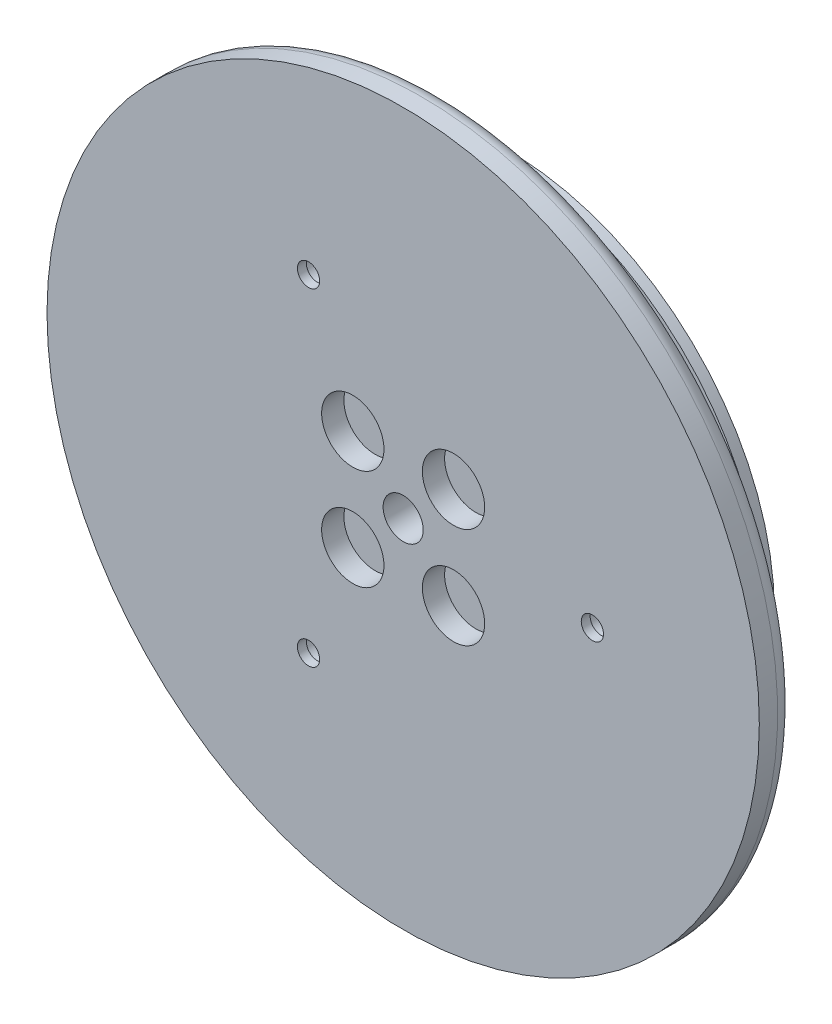
from build123d import *

# Parameters (mm, degrees)
SKETCH1_R             = 30
SKETCH1_R_2           = 12.5
BOSS_EXTRUDE1_DEPTH   = 6
SKETCH2_R             = 40
SKETCH2_R_2           = 2.25
SKETCH2_R_3           = 1.5
BOSS_EXTRUDE2_DEPTH   = 4
SKETCH3_R             = 3.5
CUT_EXTRUDE1_DEPTH    = 2.5
SKETCH4_R             = 5.15
CUT_EXTRUDE2_DEPTH    = 3
SKETCH5_R             = 3.5
BOSS_EXTRUDE3_DEPTH   = 0.2
SKETCH6_R             = 1.25
CUT_EXTRUDE3_DEPTH    = 10
SKETCH7_R             = 3.125
CUT_EXTRUDE4_DEPTH    = 9
SKETCH8_R             = 2
CUT_EXTRUDE5_DEPTH    = 8
SKETCH9_R             = 3
BOSS_EXTRUDE4_DEPTH   = 0.5
BOSS_EXTRUDE4_2_DEPTH = 0.5
BOSS_EXTRUDE4_3_DEPTH = 0.5
SKETCH11_R            = 3
SKETCH11_R_2          = 1.5
BOSS_EXTRUDE6_DEPTH   = 3
BOSS_EXTRUDE6_2_DEPTH = 3
BOSS_EXTRUDE6_3_DEPTH = 3
SKETCH10_R            = 30
SKETCH10_R_2          = 12.5
SKETCH10_R_3          = 5.15
SKETCH10_R_4          = 2
SKETCH10_R_5          = 3
BOSS_EXTRUDE7_DEPTH   = 1.2
FILLET1_R             = 10
FILLET2_R             = 2
BOSS_EXTRUDE8_START   = 2
SKETCH12_R            = 12.5
SKETCH12_R_2          = 2.25
SKETCH12_R_3          = 1.5
BOSS_EXTRUDE8_DEPTH   = 2
SKETCH13_R            = 3.125
BOSS_EXTRUDE9_DEPTH   = 1
FILLET3_R             = 1.5


with BuildPart() as part:
    # Sketch1 → Boss-Extrude1 (new body)
    with BuildSketch(Plane.XY):
        Circle(SKETCH1_R)
        Circle(SKETCH1_R_2, mode=Mode.SUBTRACT)
    extrude(amount=BOSS_EXTRUDE1_DEPTH)

    # Sketch2 → Boss-Extrude2 (add)
    with BuildSketch(Plane.XY.offset(6)):
        Circle(SKETCH2_R)
        Circle(SKETCH2_R_2, mode=Mode.SUBTRACT)
        with Locations((-5.655999742, 5.657708628)):
            Circle(SKETCH2_R_3, mode=Mode.SUBTRACT)
        with Locations((-5.655999742, -5.657708628)):
            Circle(SKETCH2_R_3, mode=Mode.SUBTRACT)
        with Locations((5.655999742, -5.657708628)):
            Circle(SKETCH2_R_3, mode=Mode.SUBTRACT)
        with Locations((5.655999742, 5.657708628)):
            Circle(SKETCH2_R_3, mode=Mode.SUBTRACT)
    extrude(amount=BOSS_EXTRUDE2_DEPTH)

    # Sketch3 → Cut-Extrude1 (cut)
    with BuildSketch(Plane.XY.offset(10)):
        with Locations((-5.655999742, 5.657708628)):
            Circle(SKETCH3_R)
        with Locations((5.655999742, 5.657708628)):
            Circle(SKETCH3_R)
        with Locations((5.655999742, -5.657708628)):
            Circle(SKETCH3_R)
        with Locations((-5.655999742, -5.657708628)):
            Circle(SKETCH3_R)
    extrude(amount=-CUT_EXTRUDE1_DEPTH, mode=Mode.SUBTRACT)

    # Sketch4 → Cut-Extrude2 (cut)
    with BuildSketch(Plane(origin=(0, 0, 0), x_dir=(-1, 0, 0), z_dir=(0, 0, -1))):
        with Locations((20, 0)):
            Circle(SKETCH4_R)
    extrude(amount=-CUT_EXTRUDE2_DEPTH, mode=Mode.SUBTRACT)

    # Sketch5 → Boss-Extrude3 (add)
    with BuildSketch(Plane.XY.offset(7.5)):
        with Locations((-5.655999742, 5.657708628)):
            Circle(SKETCH5_R)
        with Locations((5.655999742, 5.657708628)):
            Circle(SKETCH5_R)
        with Locations((-5.655999742, -5.657708628)):
            Circle(SKETCH5_R)
        with Locations((5.655999742, -5.657708628)):
            Circle(SKETCH5_R)
    extrude(amount=-BOSS_EXTRUDE3_DEPTH)

    # Sketch6 → Cut-Extrude3 (cut)
    with BuildSketch(Plane(origin=(0, 0, 0), x_dir=(-1, 0, 0), z_dir=(0, 0, -1))):
        with Locations((-21.25, 0)):
            Circle(SKETCH6_R)
        with Locations((10.625, 18.40303983)):
            Circle(SKETCH6_R)
        with Locations((10.625, -18.40303983)):
            Circle(SKETCH6_R)
    extrude(amount=-CUT_EXTRUDE3_DEPTH, mode=Mode.SUBTRACT)

    # Sketch7 → Cut-Extrude4 (cut)
    with BuildSketch(Plane(origin=(0, 0, 0), x_dir=(-1, 0, 0), z_dir=(0, 0, -1))):
        with Locations((-21.25, 0)):
            Circle(SKETCH7_R)
        with Locations((10.625, 18.40303983)):
            Circle(SKETCH7_R)
        with Locations((10.625, -18.40303983)):
            Circle(SKETCH7_R)
    extrude(amount=-CUT_EXTRUDE4_DEPTH, mode=Mode.SUBTRACT)

    # Sketch8 → Cut-Extrude5 (cut)
    with BuildSketch(Plane(origin=(0, 0, 0), x_dir=(-1, 0, 0), z_dir=(0, 0, -1))):
        with Locations((17.320508076, -10)):
            Circle(SKETCH8_R)
        with Locations((0, -20)):
            Circle(SKETCH8_R)
        with Locations((-17.320508076, -10)):
            Circle(SKETCH8_R)
        with Locations((-17.320508076, 10)):
            Circle(SKETCH8_R)
        with Locations((0, 20)):
            Circle(SKETCH8_R)
        with Locations((17.320508076, 10)):
            Circle(SKETCH8_R)
    extrude(amount=-CUT_EXTRUDE5_DEPTH, mode=Mode.SUBTRACT)

    # Fillet1
    # the kernel refuses this fillet: 10 mm, written as the material it adds along each edge
    with BuildSketch(Plane(origin=(0, 0, 6), x_dir=(1, 0, 0), z_dir=(0, -1, 0))) as fillet1_piece_1:
        with BuildLine():
            CenterArc((39.16515139, -10), FILLET1_R, 90, 66.421821522)
            Line((30, -6), (29.816696972, -5.92))
            ThreePointArc((29.816696972, -5.92), (29.8, -3), (29.8, 0))
            Line((29.8, 0), (30, 0.2))
            Line((30, 0.2), (39.16515139, 0.2))
            Line((39.16515139, 0.2), (39.16515139, 0))
        make_face()
    revolve(axis=Axis((0, 0, 6), (0, 0, 1)))

    # Fillet2
    fillet2_edges = [part.edges().sort_by_distance(p)[0] for p in [
        (-40, 0, 6),
    ]]
    fillet(fillet2_edges, radius=FILLET2_R)

    # Sketch12 → Boss-Extrude8 (add)
    with BuildSketch(Plane(origin=(0, 0, 6), x_dir=(-1, 0, 0), z_dir=(0, 0, -1)).offset(BOSS_EXTRUDE8_START)):
        Circle(SKETCH12_R)
        Circle(SKETCH12_R_2, mode=Mode.SUBTRACT)
        with Locations((-5.655999742, 5.657708628)):
            Circle(SKETCH12_R_3, mode=Mode.SUBTRACT)
        with Locations((5.655999742, 5.657708628)):
            Circle(SKETCH12_R_3, mode=Mode.SUBTRACT)
        with Locations((5.655999742, -5.657708628)):
            Circle(SKETCH12_R_3, mode=Mode.SUBTRACT)
        with Locations((-5.655999742, -5.657708628)):
            Circle(SKETCH12_R_3, mode=Mode.SUBTRACT)
    extrude(amount=-BOSS_EXTRUDE8_DEPTH)


with BuildPart() as body_2:
    # Sketch9 → Boss-Extrude4 (new body)
    with BuildSketch(Plane(origin=(0, 0, 0), x_dir=(-1, 0, 0), z_dir=(0, 0, -1))):
        with Locations((-21.25, 0)):
            Circle(SKETCH9_R)
    extrude(amount=BOSS_EXTRUDE4_DEPTH)


with BuildPart() as body_3:
    # Sketch9 → Boss-Extrude4 2 (new body)
    with BuildSketch(Plane(origin=(0, 0, 0), x_dir=(-1, 0, 0), z_dir=(0, 0, -1))):
        with Locations((10.625, 18.40303983)):
            Circle(SKETCH9_R)
    extrude(amount=BOSS_EXTRUDE4_2_DEPTH)


with BuildPart() as body_4:
    # Sketch9 → Boss-Extrude4 3 (new body)
    with BuildSketch(Plane(origin=(0, 0, 0), x_dir=(-1, 0, 0), z_dir=(0, 0, -1))):
        with Locations((10.625, -18.40303983)):
            Circle(SKETCH9_R)
    extrude(amount=BOSS_EXTRUDE4_3_DEPTH)


with BuildPart() as body_5:
    # Sketch11 → Boss-Extrude6 (new body)
    with BuildSketch(Plane(origin=(0, 0, 9), x_dir=(-1, 0, 0), z_dir=(0, 0, -1))):
        with Locations((-21.25, 0)):
            Circle(SKETCH11_R)
        with Locations((-21.25, 0)):
            Circle(SKETCH11_R_2, mode=Mode.SUBTRACT)
    extrude(amount=BOSS_EXTRUDE6_DEPTH)


with BuildPart() as body_6:
    # Sketch11 → Boss-Extrude6 2 (new body)
    with BuildSketch(Plane(origin=(0, 0, 9), x_dir=(-1, 0, 0), z_dir=(0, 0, -1))):
        with Locations((10.625, 18.40303983)):
            Circle(SKETCH11_R)
        with Locations((10.625, 18.40303983)):
            Circle(SKETCH11_R_2, mode=Mode.SUBTRACT)
    extrude(amount=BOSS_EXTRUDE6_2_DEPTH)


with BuildPart() as body_7:
    # Sketch11 → Boss-Extrude6 3 (new body)
    with BuildSketch(Plane(origin=(0, 0, 9), x_dir=(-1, 0, 0), z_dir=(0, 0, -1))):
        with Locations((10.625, -18.40303983)):
            Circle(SKETCH11_R)
        with Locations((10.625, -18.40303983)):
            Circle(SKETCH11_R_2, mode=Mode.SUBTRACT)
    extrude(amount=BOSS_EXTRUDE6_3_DEPTH)


with BuildPart() as body_8:
    # Sketch10 → Boss-Extrude7 (new body)
    # profile 1 of 2: a face of its own
    with BuildSketch(Plane(origin=(0, 0, -0.5), x_dir=(-1, 0, 0), z_dir=(0, 0, -1))):
        Circle(SKETCH10_R)
        Circle(SKETCH10_R_2, mode=Mode.SUBTRACT)
        with Locations((20, 0)):
            Circle(SKETCH10_R_3, mode=Mode.SUBTRACT)
        with Locations((-17.320508076, 10)):
            Circle(SKETCH10_R_4, mode=Mode.SUBTRACT)
        with Locations((0, 20)):
            Circle(SKETCH10_R_4, mode=Mode.SUBTRACT)
        with Locations((17.320508076, 10)):
            Circle(SKETCH10_R_4, mode=Mode.SUBTRACT)
        with Locations((17.320508076, -10)):
            Circle(SKETCH10_R_4, mode=Mode.SUBTRACT)
        with Locations((0, -20)):
            Circle(SKETCH10_R_4, mode=Mode.SUBTRACT)
        with Locations((-17.320508076, -10)):
            Circle(SKETCH10_R_4, mode=Mode.SUBTRACT)
        with Locations((10.625, 18.40303983)):
            Circle(SKETCH10_R_5, mode=Mode.SUBTRACT)
    # profile 2 of 2: a face of its own
    with BuildSketch(Plane(origin=(0, 0, -0.5), x_dir=(-1, 0, 0), z_dir=(0, 0, -1))):
        with Locations((10.625, 18.40303983)):
            Circle(SKETCH10_R_5)
    extrude(amount=BOSS_EXTRUDE7_DEPTH)

    # Sketch13 → Boss-Extrude9 (add)
    with BuildSketch(Plane.XY.offset(-0.5)):
        with Locations((21.25, 0)):
            Circle(SKETCH13_R)
        with Locations((-10.625, 18.40303983)):
            Circle(SKETCH13_R)
        with Locations((-10.625, -18.40303983)):
            Circle(SKETCH13_R)
    extrude(amount=BOSS_EXTRUDE9_DEPTH)

    # Fillet3
    # the kernel refuses this fillet: 1.5 mm, written as the material it takes off along each edge
    with BuildSketch(Plane(origin=(21.25, 0, 0.5), x_dir=(1, 0, 0), z_dir=(0, -1, 0))) as fillet3_piece_1:
        with BuildLine():
            CenterArc((1.710786438, -1.5), FILLET3_R, 19.471220634, 70.528779366)
            Line((1.710786438, 0), (1.710786438, 0.03))
            Line((1.710786438, 0.03), (3.125, 0.03))
            Line((3.125, 0.03), (3.155, 0))
            ThreePointArc((3.155, 0), (3.155, -0.5), (3.153284271, -0.99))
            Line((3.153284271, -0.99), (3.125, -1))
        make_face()
    revolve(axis=Axis((21.25, 0, 0.5), (0, 0, 1)), mode=Mode.SUBTRACT)
    with BuildSketch(Plane(origin=(-10.625, 18.40303983, 0.5), x_dir=(1, 0, 0), z_dir=(0, -1, 0))) as fillet3_piece_2:
        with BuildLine():
            CenterArc((1.710786438, -1.5), FILLET3_R, 19.471220634, 70.528779366)
            Line((1.710786438, 0), (1.710786438, 0.03))
            Line((1.710786438, 0.03), (3.125, 0.03))
            Line((3.125, 0.03), (3.155, 0))
            ThreePointArc((3.155, 0), (3.155, -0.5), (3.153284271, -0.99))
            Line((3.153284271, -0.99), (3.125, -1))
        make_face()
    revolve(axis=Axis((-10.625, 18.40303983, 0.5), (0, 0, 1)), mode=Mode.SUBTRACT)
    with BuildSketch(Plane(origin=(-10.625, -18.40303983, 0.5), x_dir=(1, 0, 0), z_dir=(0, -1, 0))) as fillet3_piece_3:
        with BuildLine():
            CenterArc((1.710786438, -1.5), FILLET3_R, 19.471220634, 70.528779366)
            Line((1.710786438, 0), (1.710786438, 0.03))
            Line((1.710786438, 0.03), (3.125, 0.03))
            Line((3.125, 0.03), (3.155, 0))
            ThreePointArc((3.155, 0), (3.155, -0.5), (3.153284271, -0.99))
            Line((3.153284271, -0.99), (3.125, -1))
        make_face()
    revolve(axis=Axis((-10.625, -18.40303983, 0.5), (0, 0, 1)), mode=Mode.SUBTRACT)


solid = Compound([part.part, body_5.part, body_6.part, body_7.part, body_8.part])
